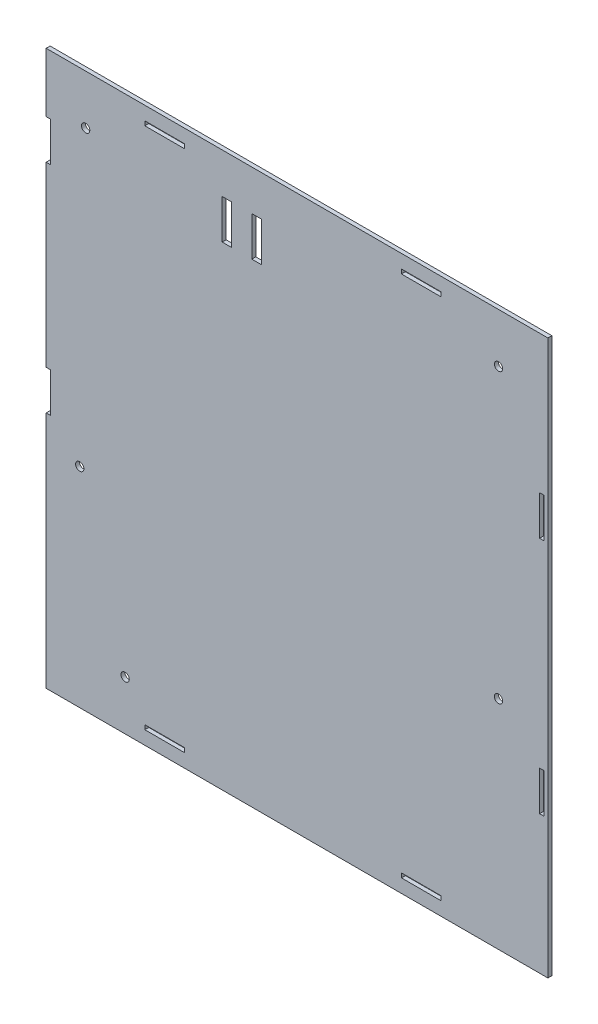
from build123d import *

# Parameters (mm, degrees)
SKETCH1_W           = 254.2
SKETCH1_H           = 280.866666666
SKETCH1_W_2         = 20
SKETCH1_H_2         = 2.2
SKETCH1_W_3         = 2.2
SKETCH1_H_3         = 20
BOSS_EXTRUDE1_DEPTH = 2
SKETCH2_W           = 4.8
SKETCH2_H           = 20
CUT_EXTRUDE1_DEPTH  = 5
SKETCH3_R           = 2.1
CUT_EXTRUDE2_DEPTH  = 5
SKETCH4_R           = 2.1
CUT_EXTRUDE3_DEPTH  = 5
SKETCH5_R           = 2.1
CUT_EXTRUDE4_DEPTH  = 5
SKETCH6_R           = 2.1
CUT_EXTRUDE5_DEPTH  = 5
SKETCH7_W           = 2.2
SKETCH7_H           = 20
CUT_EXTRUDE6_DEPTH  = 10


with BuildPart() as part:
    # Sketch1 → Boss-Extrude1 (new body)
    with BuildSketch(Plane.XY):
        with Locations((-122.9, 135)):
            Rectangle(SKETCH1_W, SKETCH1_H)
        with Locations((-60, 267.5)):
            Rectangle(SKETCH1_W_2, SKETCH1_H_2, mode=Mode.SUBTRACT)
        with Locations((1.1, 74.566666667)):
            Rectangle(SKETCH1_W_3, SKETCH1_H_3, mode=Mode.SUBTRACT)
        with Locations((-190, 2.5)):
            Rectangle(SKETCH1_W_2, SKETCH1_H_2, mode=Mode.SUBTRACT)
        with Locations((1.1, 195.433333333)):
            Rectangle(SKETCH1_W_3, SKETCH1_H_3, mode=Mode.SUBTRACT)
        with Locations((-60, 2.5)):
            Rectangle(SKETCH1_W_2, SKETCH1_H_2, mode=Mode.SUBTRACT)
        with Locations((-190, 267.5)):
            Rectangle(SKETCH1_W_2, SKETCH1_H_2, mode=Mode.SUBTRACT)
    extrude(amount=BOSS_EXTRUDE1_DEPTH)

    # Sketch2 → Cut-Extrude1 (cut)
    with BuildSketch(Plane.XY.offset(2)):
        with Locations((-143.405234687, 245)):
            Rectangle(SKETCH2_W, SKETCH2_H)
        with Locations((-158.405234687, 245)):
            Rectangle(SKETCH2_W, SKETCH2_H)
    extrude(amount=-CUT_EXTRUDE1_DEPTH, mode=Mode.SUBTRACT)

    # Sketch3 → Cut-Extrude2 (cut)
    with BuildSketch(Plane.XY.offset(2)):
        with Locations((-230, 250.433333333)):
            Circle(SKETCH3_R)
        with Locations((-20.8, 250.433333333)):
            Circle(SKETCH3_R)
    extrude(amount=-CUT_EXTRUDE2_DEPTH, mode=Mode.SUBTRACT)

    # Sketch4 → Cut-Extrude3 (cut)
    with BuildSketch(Plane.XY.offset(2)):
        with Locations((-210, 19.566666667)):
            Circle(SKETCH4_R)
    extrude(amount=-CUT_EXTRUDE3_DEPTH, mode=Mode.SUBTRACT)

    # Sketch5 → Cut-Extrude4 (cut)
    with BuildSketch(Plane.XY.offset(2)):
        with Locations((-20.8, 104.566666667)):
            Circle(SKETCH5_R)
    extrude(amount=-CUT_EXTRUDE4_DEPTH, mode=Mode.SUBTRACT)

    # Sketch6 → Cut-Extrude5 (cut)
    with BuildSketch(Plane.XY.offset(2)):
        with Locations((-233, 100.433333333)):
            Circle(SKETCH6_R)
    extrude(amount=-CUT_EXTRUDE5_DEPTH, mode=Mode.SUBTRACT)

    # Sketch7 → Cut-Extrude6 (cut)
    with BuildSketch(Plane.XY.offset(2)):
        with Locations((-248.9, 235.433333333)):
            Rectangle(SKETCH7_W, SKETCH7_H)
        with Locations((-248.9, 125.433333333)):
            Rectangle(SKETCH7_W, SKETCH7_H)
    extrude(amount=-CUT_EXTRUDE6_DEPTH, mode=Mode.SUBTRACT)


solid = part.part
